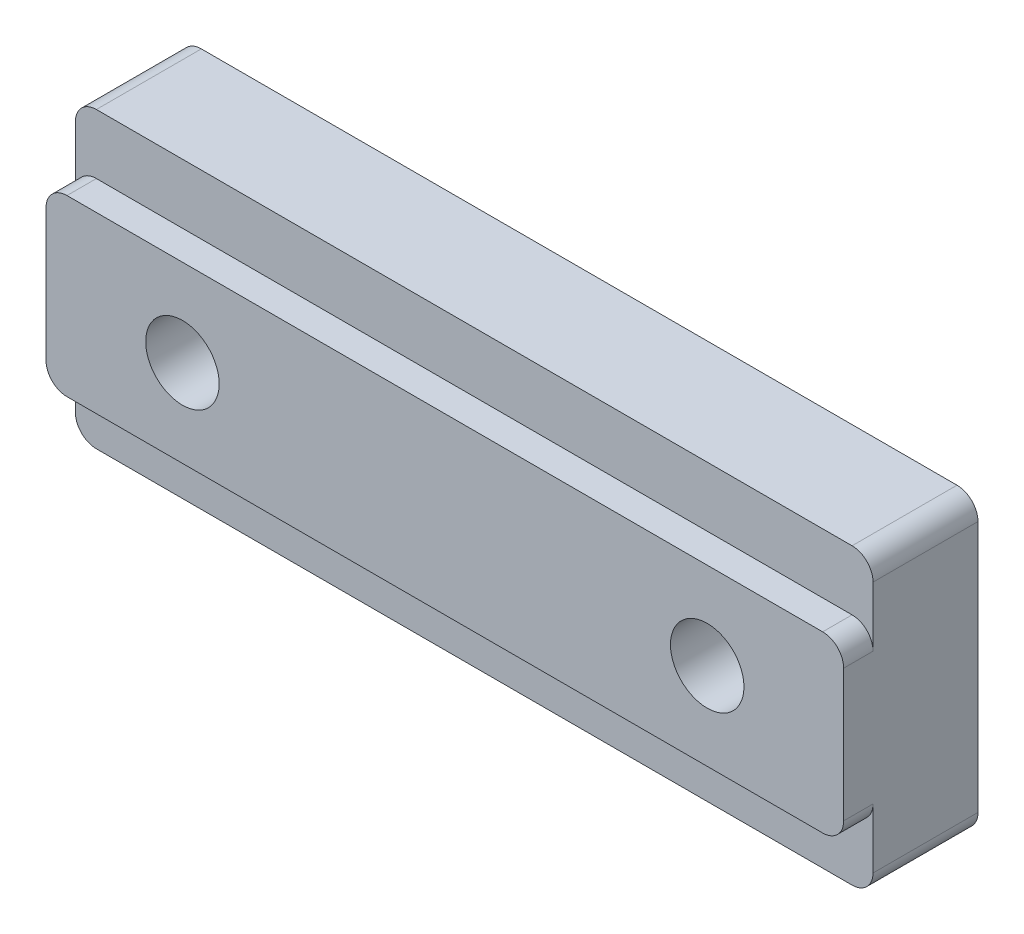
from build123d import *

# Parameters (mm, degrees)
SKETCH_1_W          = 38
SKETCH_1_H          = 2.85
SKETCH_1_H_2        = 8.3
SKETCH_1_R          = 1.75
EXTRUDE_1_DEPTH     = 5
SKETCH_1_3_W        = 38
SKETCH_1_3_H        = 8.3
SKETCH_1_3_R        = 1.75
EXTRUDE_2_DEPTH     = 6.4
CUT_EXTRUDE_1_DEPTH = 2.5
FILLET_1_R          = 1
CHAMFER_1_SIZE      = 1.3
CHAMFER_1_SIZE_2    = 1.54927967


with BuildPart() as part:
    # Эскиз1 → Бобышка-Вытянуть1 (new body)
    # profile 1 of 3: a face of its own
    with BuildSketch(Plane.XY):
        with Locations((0, -5.575)):
            Rectangle(SKETCH_1_W, SKETCH_1_H)
    # profile 2 of 3: a face of its own
    with BuildSketch(Plane.XY):
        Rectangle(SKETCH_1_W, SKETCH_1_H_2)
        with Locations((-12.5, 0)):
            Circle(SKETCH_1_R, mode=Mode.SUBTRACT)
        with Locations((12.5, 0)):
            Circle(SKETCH_1_R, mode=Mode.SUBTRACT)
    # profile 3 of 3: a face of its own
    with BuildSketch(Plane.XY):
        with Locations((0, 5.575)):
            Rectangle(SKETCH_1_W, SKETCH_1_H)
    extrude(amount=EXTRUDE_1_DEPTH)

    # Эскиз1<3> → Бобышка-Вытянуть2 (add)
    with BuildSketch(Plane.XY):
        Rectangle(SKETCH_1_3_W, SKETCH_1_3_H)
        with Locations((-12.5, 0)):
            Circle(SKETCH_1_3_R, mode=Mode.SUBTRACT)
        with Locations((12.5, 0)):
            Circle(SKETCH_1_3_R, mode=Mode.SUBTRACT)
    extrude(amount=EXTRUDE_2_DEPTH)

    # Эскиз2 → Вырез-Вытянуть1 (cut)
    with BuildSketch(Plane(origin=(0, 0, 0), x_dir=(-1, 0, 0), z_dir=(0, 0, -1))):
        Polygon((-12.5, 3.348631561), (-15.4, 1.674315781), (-15.4, -1.674315781), (-12.5, -3.348631561), (-9.6, -1.674315781), (-9.6, 1.674315781), align=None)
        Polygon((9.6, 1.674315781), (12.5, 3.348631561), (15.4, 1.674315781), (15.4, -1.674315781), (12.5, -3.348631561), (9.6, -1.674315781), align=None)
    extrude(amount=-CUT_EXTRUDE_1_DEPTH, mode=Mode.SUBTRACT)

    # Скругление1
    fillet_1_edges = [part.edges().sort_by_distance(p)[0] for p in [
        (19, -7, 2.5),
        (-19, -7, 2.5),
        (-19, 7, 2.5),
        (19, 7, 2.5),
        (19, 4.15, 5.7),
        (-19, 4.15, 5.7),
        (-19, -4.15, 5.7),
        (19, -4.15, 5.7),
    ]]
    fillet(fillet_1_edges, radius=FILLET_1_R)

    # Фаска1
    # the kernel refuses this chamfer: 1.54927967, 1.3 mm, written as the material it takes off along each edge
    with BuildSketch(Plane(origin=(12.5, 0, 2.5), x_dir=(1, 0, 0), z_dir=(0, 1, 0))) as chamfer_1_piece_1_section:
        Polygon((1.75, -CHAMFER_1_SIZE), (1.75 + CHAMFER_1_SIZE_2, 0), (1.75, 0), align=None)
    chamfer_1_piece_1 = revolve(axis=Axis((12.5, 0, 2.5), (0, 0, -1)), mode=Mode.PRIVATE)
    chamfer_1_piece_1 = split(chamfer_1_piece_1, bisect_by=Plane(origin=(12.068379037, 3.597828041, 3.131156131), z_dir=(-0.4999999999999998, -0.8660254037844388, 0)), keep=Keep.TOP, mode=Mode.PRIVATE)
    chamfer_1_piece_1 = split(chamfer_1_piece_1, bisect_by=Plane(origin=(9.168379037, 1.425119301, 3.131156131), z_dir=(0.5000000000000004, -0.8660254037844385, 0)), keep=Keep.TOP, mode=Mode.PRIVATE)
    chamfer_1_piece_1 = split(chamfer_1_piece_1, bisect_by=Plane(origin=(15.4, 0, 3.131156131), z_dir=(-1, 0, 0)), keep=Keep.TOP, mode=Mode.PRIVATE)
    chamfer_1_piece_1 = split(chamfer_1_piece_1, bisect_by=Plane(origin=(9.6, 0, 3.131156131), z_dir=(1, 0, 0)), keep=Keep.TOP, mode=Mode.PRIVATE)
    chamfer_1_piece_1 = split(chamfer_1_piece_1, bisect_by=Plane(origin=(12.068379037, -3.597828041, 3.131156131), z_dir=(-0.4999999999999998, 0.8660254037844388, 0)), keep=Keep.TOP, mode=Mode.PRIVATE)
    chamfer_1_piece_1 = split(chamfer_1_piece_1, bisect_by=Plane(origin=(9.168379037, -1.425119301, 3.131156131), z_dir=(0.5000000000000001, 0.8660254037844386, 0)), keep=Keep.TOP, mode=Mode.PRIVATE)
    add(chamfer_1_piece_1, mode=Mode.SUBTRACT)
    with BuildSketch(Plane(origin=(-12.5, 0, 2.5), x_dir=(1, 0, 0), z_dir=(0, 1, 0))) as chamfer_1_piece_2_section:
        Polygon((1.75, -CHAMFER_1_SIZE), (1.75 + CHAMFER_1_SIZE_2, 0), (1.75, 0), align=None)
    chamfer_1_piece_2 = revolve(axis=Axis((-12.5, 0, 2.5), (0, 0, -1)), mode=Mode.PRIVATE)
    chamfer_1_piece_2 = split(chamfer_1_piece_2, bisect_by=Plane(origin=(-12.931620963, 3.597828041, 3.131156131), z_dir=(-0.5000000000000004, -0.8660254037844385, 0)), keep=Keep.TOP, mode=Mode.PRIVATE)
    chamfer_1_piece_2 = split(chamfer_1_piece_2, bisect_by=Plane(origin=(-9.6, 0, 3.131156131), z_dir=(-1, 0, 0)), keep=Keep.TOP, mode=Mode.PRIVATE)
    chamfer_1_piece_2 = split(chamfer_1_piece_2, bisect_by=Plane(origin=(-15.831620963, 1.425119301, 3.131156131), z_dir=(0.4999999999999998, -0.8660254037844388, 0)), keep=Keep.TOP, mode=Mode.PRIVATE)
    chamfer_1_piece_2 = split(chamfer_1_piece_2, bisect_by=Plane(origin=(-12.931620963, -3.597828041, 3.131156131), z_dir=(-0.5000000000000001, 0.8660254037844386, 0)), keep=Keep.TOP, mode=Mode.PRIVATE)
    chamfer_1_piece_2 = split(chamfer_1_piece_2, bisect_by=Plane(origin=(-15.4, 0, 3.131156131), z_dir=(1, 0, 0)), keep=Keep.TOP, mode=Mode.PRIVATE)
    chamfer_1_piece_2 = split(chamfer_1_piece_2, bisect_by=Plane(origin=(-15.831620963, -1.425119301, 3.131156131), z_dir=(0.4999999999999998, 0.8660254037844388, 0)), keep=Keep.TOP, mode=Mode.PRIVATE)
    add(chamfer_1_piece_2, mode=Mode.SUBTRACT)


solid = part.part
